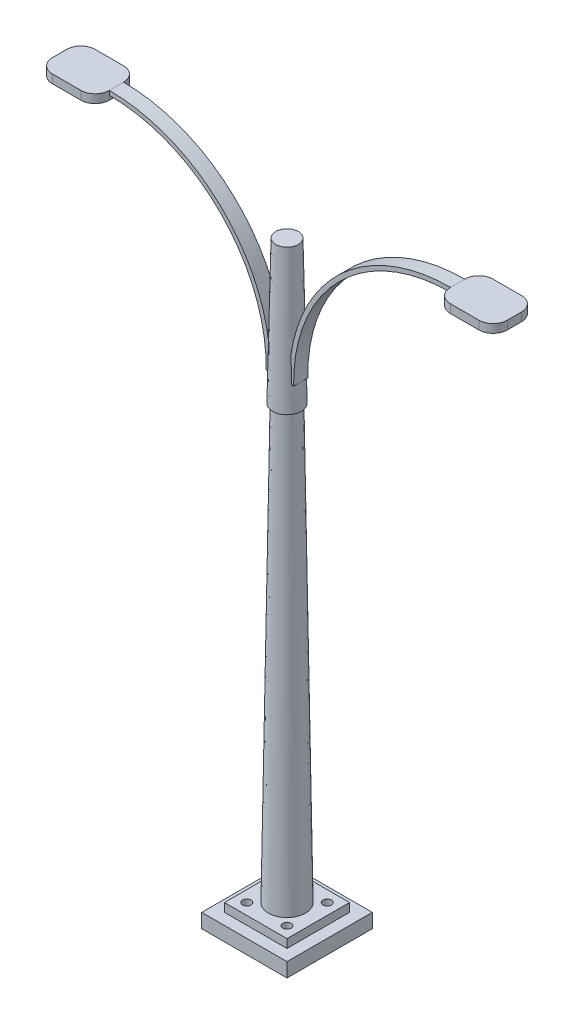
from build123d import *

# Parameters (mm, degrees)
SKETCH3_W           = 30
SKETCH3_H           = 30
BOSS_EXTRUDE2_DEPTH = 5
SKETCH4_W           = 22
SKETCH4_H           = 22
BOSS_EXTRUDE3_DEPTH = 3
SKETCH10_R          = 1.5
CUT_EXTRUDE2_DEPTH  = 23.671568098
BOSS_EXTRUDE4_DEPTH = 2.5
SKETCH13_W          = 20
SKETCH13_H          = 3
BOSS_EXTRUDE6_DEPTH = 7.5
FILLET1_R           = 5
MIRROR2_START       = 223.674571743
MIRROR2_OUTLINE_W   = 20
MIRROR2_OUTLINE_H   = 15
MIRROR2_DEPTH       = 3
FILLET2_R           = 5


# Read off the part's stored shape, not the designer's step: Loft-Thin2, Mirror2
with BuildPart() as part:
    # Sketch3 → Boss-Extrude2 (new body)
    with BuildSketch(Plane(origin=(0, 0, 0), x_dir=(1, 0, 0), z_dir=(0, 1, 0))):
        Rectangle(SKETCH3_W, SKETCH3_H)
    extrude(amount=BOSS_EXTRUDE2_DEPTH)

    # Sketch4 → Boss-Extrude3 (add)
    with BuildSketch(Plane(origin=(0, 5, 0), x_dir=(1, 0, 0), z_dir=(0, 1, 0))):
        Rectangle(SKETCH4_W, SKETCH4_H)
    extrude(amount=BOSS_EXTRUDE3_DEPTH)

    # Sketch10 → Cut-Extrude2 (cut, through all)
    with BuildSketch(Plane(origin=(0, 8, 0), x_dir=(1, 0, 0), z_dir=(0, 1, 0))):
        with Locations(Location((-7.071067812, -7.071067812, 0), (0, 0, 270))):
            Circle(SKETCH10_R)
        with Locations(Location((-7.071067812, 7.071067812, 0), (0, 0, 270))):
            Circle(SKETCH10_R)
        with Locations(Location((7.071067812, 7.071067812, 0), (0, 0, 270))):
            Circle(SKETCH10_R)
        with Locations(Location((7.071067812, -7.071067812, 0), (0, 0, 270))):
            Circle(SKETCH10_R)
    extrude(amount=-CUT_EXTRUDE2_DEPTH, mode=Mode.SUBTRACT)

    # Loft-Thin2 outline → Loft-Thin2 (revolve)
    with BuildSketch(Plane.XY):
        Polygon((3.5, 208), (1.499775013, 208), (4.499775013, 8), (6.5, 8), align=None)
    revolve(axis=Axis((0, 0, 0), (0, 1, 0)))

    # Sketch11 → Revolve1 (revolve)
    with BuildSketch(Plane.XY, mode=Mode.PRIVATE) as revolve1_sk:
        Polygon((0, 210.463271105), (3.974140239, 210.463271105), (5.018302856, 160.147044177), (4.217794337, 160.147044177), (3.476729187, 208), (0, 208), align=None)
    revolve(revolve1_sk.sketch.rotate(Axis((0, 233.744226316, 0), (0, -1, 0)), 90), axis=Axis((0, 233.744226316, 0), (0, -1, 0)))

    # Sketch12 → Boss-Extrude4 (add, symmetric)
    with BuildSketch(Plane.XY):
        with BuildLine():
            ThreePointArc((4.833910275, 169.032574831), (20.64513273, 208.670761425), (59.999990588, 225.174571743))
            Line((59.999990588, 225.174571743), (60, 226.674571743))
            ThreePointArc((60, 226.674571743), (19.584436851, 209.731465334), (3.333685749, 169.032574831))
            Line((3.333685749, 169.032574831), (4.833910275, 169.032574831))
        make_face()
    boss_extrude4 = extrude(amount=BOSS_EXTRUDE4_DEPTH, both=True)

    # Mirror1: Boss-Extrude4 across plane
    add(boss_extrude4.mirror(Plane(origin=(0, 0, 0), x_dir=(0, 0, 1), z_dir=(1, 0, 0))))


with BuildPart() as boss_extrude6_tool:
    # Sketch13 → Boss-Extrude6 (new, symmetric)
    with BuildSketch(Plane.XY):
        with Locations((70, 225.174571743)):
            Rectangle(SKETCH13_W, SKETCH13_H)
    extrude(amount=BOSS_EXTRUDE6_DEPTH, both=True)


with BuildPart() as part_1:
    add(part.part)


with BuildPart() as part_2:
    # Boss-Extrude6: joined with boss_extrude6_tool
    add(part_1.part.fuse(boss_extrude6_tool.part, tol=0.00001))

    # Fillet1
    fillet1_edges = [part_2.edges().sort_by_distance(p)[0] for p in [
        (60, 225.174571743, -7.5),
        (80, 225.174571743, -7.5),
        (80, 225.174571743, 7.5),
        (60, 225.174571743, 7.5),
    ]]
    fillet(fillet1_edges, radius=FILLET1_R - 0.0001)  # a hair under: the kernel refuses the full size


with BuildPart() as mirror2_tool:
    # Mirror2 outline → Mirror2 (new body)
    with BuildSketch(Plane(origin=(0, 0, 0), x_dir=(1, 0, 0), z_dir=(0, 1, 0)).offset(MIRROR2_START)):
        with Locations((-70, 0)):
            Rectangle(MIRROR2_OUTLINE_W, MIRROR2_OUTLINE_H)
    extrude(amount=MIRROR2_DEPTH)


with BuildPart() as part_3:
    add(part_2.part)


with BuildPart() as part_4:
    # Mirror2: joined with mirror2_tool
    add(part_3.part.fuse(mirror2_tool.part, tol=0.00001))

    # Fillet2
    fillet2_edges = [part_4.edges().sort_by_distance(p)[0] for p in [
        (-60, 225.174571743, -7.5),
        (-80, 225.174571743, -7.5),
        (-60, 225.174571743, 7.5),
        (-80, 225.174571743, 7.5),
    ]]
    fillet(fillet2_edges, radius=FILLET2_R - 0.0001)  # a hair under: the kernel refuses the full size


solid = part_4.part
